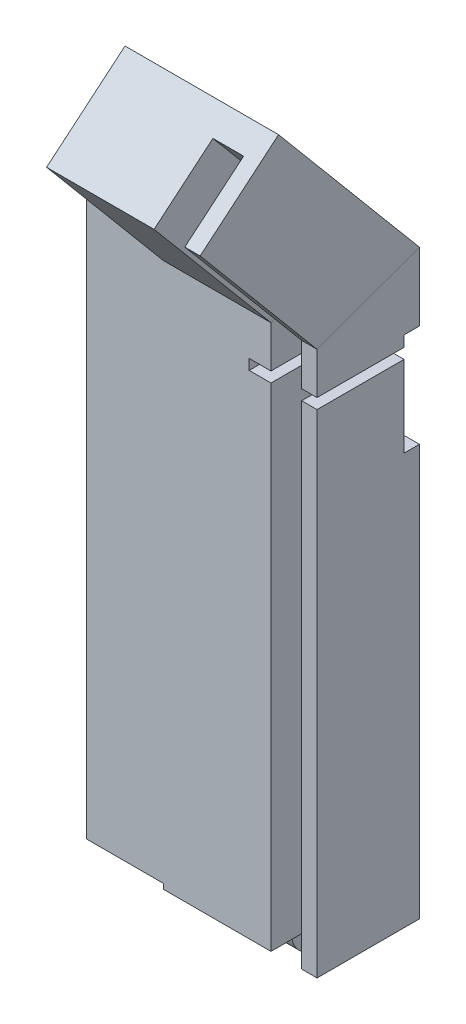
from build123d import *

# Parameters (mm, degrees)
SKETCH_1_W                = 30
SKETCH_1_H                = 20
SKETCH_3_W                = 30
SKETCH_3_H                = 10
EXTRUDE_2_DEPTH           = 10
SKETCH_4_W                = 10
SKETCH_4_H                = 10
CUT_EXTRUDE_1_DEPTH       = 15
CUT_EXTRUDE_2_DEPTH       = 15
SKETCH_6_R                = 1.5
CUT_EXTRUDE_3_DEPTH       = 15
SKETCH_8_W                = 6
SKETCH_8_H                = 15
SKETCH_12_W               = 20
SKETCH_12_H               = 110
EXTRUDE_3_DEPTH           = 15
SKETCH_14_W               = 27
SKETCH_14_H               = 53
SKETCH_14_W_2             = 32.56993007
SKETCH_14_H_2             = 48
CUT_EXTRUDE_6_DEPTH       = 17
SKETCH_18_W               = 14.5
SKETCH_18_H               = 20
CUT_EXTRUDE_7_DEPTH       = 3
SKETCH_19_W               = 13.260290085
SKETCH_19_H               = 2.030039981
CUT_EXTRUDE_8_DEPTH       = 5
CUT_EXTRUDE_START         = 96.160609199
CUT_EXTRUDE_9_OUTLINE_W   = 4.260290085
CUT_EXTRUDE_9_OUTLINE_H   = 12
CUT_EXTRUDE_9_OUTLINE_W_2 = 3
CUT_EXTRUDE_9_DEPTH       = 2.030039981


# Read off the part's stored shape, not the designer's step: 切除-拉伸9
with BuildPart() as part:
    # Sweep 1: sweep along a path in 草图2
    with BuildLine(Plane(origin=(-2.57, 0, 0), x_dir=(0, 0, -1), z_dir=(1, 0, 0))) as sweep_1_path:
        Line((-5.367132867, 0), (-5.367132867, 110))
        Line((-5.367132867, 110), (-30.540121802, 140))
    # 草图1 → Sweep 1 (sweep)
    with BuildSketch(Plane(origin=(0, 0, 0), x_dir=(1, 0, 0), z_dir=(0, 1, 0))):
        with Locations((-2.56993007, -5.367132867)):
            Rectangle(SKETCH_1_W, SKETCH_1_H)
    sweep(path=sweep_1_path.line, transition=Transition.RIGHT)

    # 草图3 → 凸台-拉伸2 (add)
    with BuildSketch(Plane.XZ):
        with Locations((-2.56993007, 0.367132867)):
            Rectangle(SKETCH_3_W, SKETCH_3_H)
    extrude(amount=EXTRUDE_2_DEPTH)

    # 草图4 → 切除-拉伸1 (cut)
    with BuildSketch(Plane(origin=(12.43006993, 0, 0), x_dir=(0, 0, -1), z_dir=(1, 0, 0))):
        with Locations((-0.367132867, -5)):
            Rectangle(SKETCH_4_W, SKETCH_4_H)
    extrude(amount=-CUT_EXTRUDE_1_DEPTH, mode=Mode.SUBTRACT)

    # 草图5 → 切除-拉伸2 (cut)
    with BuildSketch(Plane.ZY.offset(17.56993007)):
        with BuildLine():
            Line((5.367132867, -10), (0.367132867, -10))
            ThreePointArc((0.367132867, -10), (3.902666773, -8.535533906), (5.367132867, -5))
            Line((5.367132867, -5), (5.367132867, -10))
        make_face()
    extrude(amount=-CUT_EXTRUDE_2_DEPTH, mode=Mode.SUBTRACT)

    # 草图6 → 切除-拉伸3 (cut)
    with BuildSketch(Plane.ZY.offset(17.56993007)):
        with Locations((0.367132867, -5)):
            Circle(SKETCH_6_R)
    extrude(amount=-CUT_EXTRUDE_3_DEPTH, mode=Mode.SUBTRACT)

    # Sweep 1 2: sweep along a path in 草图10
    with BuildLine(Plane(origin=(6.43006993, 0, 0), x_dir=(0, 0, -1), z_dir=(1, 0, 0))) as sweep_1_2_path:
        Line((-32.45523291, 138.393030976), (-7.867132867, 109.090074414))
        Line((-7.867132867, 109.090074414), (-7.867132867, 0))
    # 草图8 → Sweep 1 2 (sweep, cut)
    with BuildSketch(Plane(origin=(0, 97.193446801, 81.554985364), x_dir=(1, 0, 0), z_dir=(0, 0.7660444431189773, 0.6427876096865403))):
        with Locations((6.43006993, 64.095174757)):
            Rectangle(SKETCH_8_W, SKETCH_8_H)
    sweep(path=sweep_1_2_path.line, transition=Transition.RIGHT, mode=Mode.SUBTRACT)

    # 草图12 → 凸台-拉伸3 (add)
    with BuildSketch(Plane.ZY.offset(17.56993007)):
        with Locations((5.367132867, 56)):
            Rectangle(SKETCH_12_W, SKETCH_12_H)
    extrude(amount=EXTRUDE_3_DEPTH)

    # 草图14 → 切除-拉伸6 (cut)
    with BuildSketch(Plane(origin=(0, 0, -4.632867133), x_dir=(-1, 0, 0), z_dir=(0, 0, -1))):
        with Locations((19.06993007, 81.5)):
            Rectangle(SKETCH_14_W, SKETCH_14_H)
        with Locations((16.284965035, 28.17035924)):
            Rectangle(SKETCH_14_W_2, SKETCH_14_H_2)
    extrude(amount=-CUT_EXTRUDE_6_DEPTH, mode=Mode.SUBTRACT)

    # 草图18 → 切除-拉伸7 (cut)
    with BuildSketch(Plane(origin=(0, 0, -4.632867133), x_dir=(-1, 0, 0), z_dir=(0, 0, -1))):
        with Locations((-5.18006993, 90.294394936)):
            Rectangle(SKETCH_18_W, SKETCH_18_H)
    extrude(amount=-CUT_EXTRUDE_7_DEPTH, mode=Mode.SUBTRACT)

    # 草图19 → 切除-拉伸8 (cut)
    with BuildSketch(Plane(origin=(0, 0, -1.632867133), x_dir=(-1, 0, 0), z_dir=(0, 0, -1))):
        with Locations((-5.799924888, 97.17562919)):
            Rectangle(SKETCH_19_W, SKETCH_19_H)
    extrude(amount=-CUT_EXTRUDE_8_DEPTH, mode=Mode.SUBTRACT)

    # 切除-拉伸9 outline → 切除-拉伸9 (cut)
    with BuildSketch(Plane(origin=(0, 0, 0), x_dir=(1, 0, 0), z_dir=(0, 1, 0)).offset(CUT_EXTRUDE_START)):
        with Locations((1.299924888, -9.367132867)):
            Rectangle(CUT_EXTRUDE_9_OUTLINE_W, CUT_EXTRUDE_9_OUTLINE_H)
        with Locations((10.93006993, -9.367132867)):
            Rectangle(CUT_EXTRUDE_9_OUTLINE_W_2, CUT_EXTRUDE_9_OUTLINE_H)
    extrude(amount=CUT_EXTRUDE_9_DEPTH, mode=Mode.SUBTRACT)


solid = part.part
